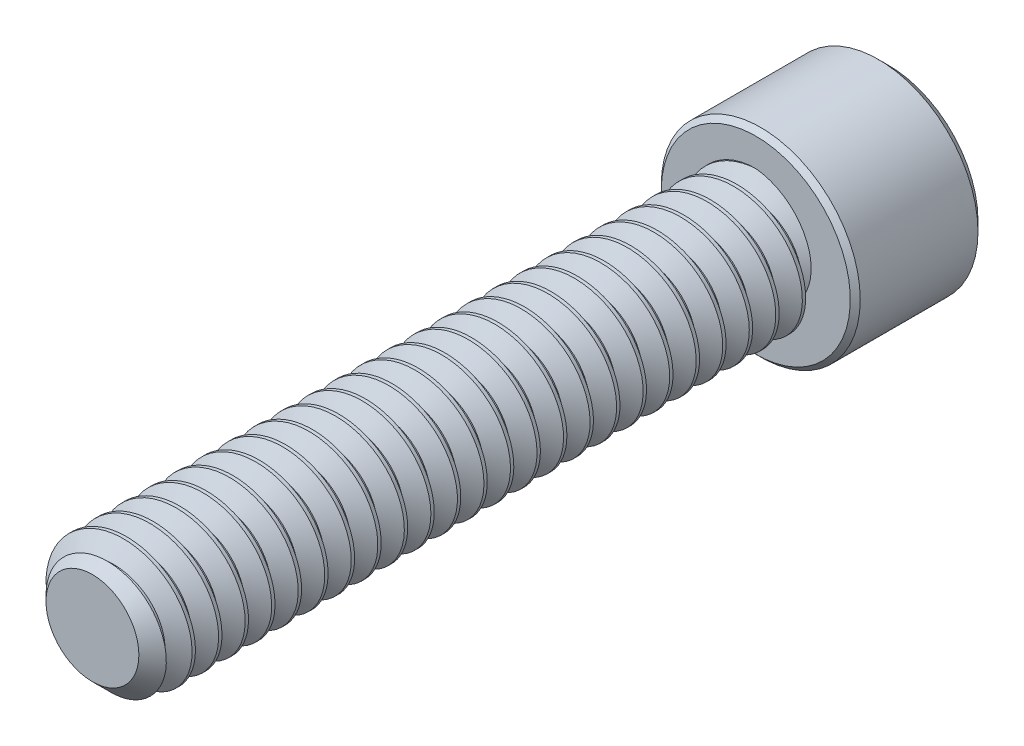
from build123d import *

# Parameters (mm, degrees)
SKETCH1_R          = 3.175
EXTRUDE1_DEPTH     = 31.75
CHAMFER3_SIZE      = 0.9525
CUT_SWEEP1_PITCH   = 1.27
SKETCH6_R          = 4.7625
EXTRUDE2_DEPTH     = 6.35
CUT_EXTRUDE1_DEPTH = 3.571875
CHAMFER1_SIZE      = 0.47625
CHAMFER2_SIZE      = 0.238125


with BuildPart() as part:
    # Sketch1 → Extrude1 (new body)
    with BuildSketch(Plane.XY):
        Circle(SKETCH1_R)
    extrude(amount=-EXTRUDE1_DEPTH)

    # Chamfer3
    chamfer3_edges = [part.edges().sort_by_distance(p)[0] for p in [
        (-3.175, 0, 0),
    ]]
    chamfer(chamfer3_edges, length=CHAMFER3_SIZE)

    # Cut-Sweep1: the profile of Sketch3 profile screwed along a right-hand helix of 26 turns, 6 arcs to a turn; built about Z, then put on its axis
    cut_sweep1_z = Axis((0, 0, 0), (0, 0, 1))
    cut_sweep1_corners = [(3.1753, 0, -1.111423205), (2.350110803, 0, -0.635), (2.350110803, 0, -0.47625), (3.1753, 0, 0.000173205)]
    with BuildLine(mode=Mode.PRIVATE) as cut_sweep1_profile:
        Line(cut_sweep1_corners[0], cut_sweep1_corners[1])
        Line(cut_sweep1_corners[1], cut_sweep1_corners[2])
        Line(cut_sweep1_corners[2], cut_sweep1_corners[3])
        Line(cut_sweep1_corners[3], cut_sweep1_corners[0])
    cut_sweep1_cap = Face(cut_sweep1_profile.wire())
    cut_sweep1_turn_angles = [0, 30, 60, 90, 120, 150, 180, 210, 240, 270, 300, 330, 360]
    cut_sweep1_turn_weights = [1, 0.8660254037844387, 1, 0.8660254037844387, 1, 0.8660254037844387, 1, 0.8660254037844387, 1, 0.8660254037844387, 1, 0.8660254037844387, 1]
    cut_sweep1_turn_rails = [Edge.make_bspline([Vector(p[0], p[1], 0).rotate(cut_sweep1_z, cut_sweep1_turn_angles[k]) / cut_sweep1_turn_weights[k] + Vector(0, 0, p[2] + CUT_SWEEP1_PITCH * cut_sweep1_turn_angles[k] / 360) for k in range(13)], [0, 0, 0, 1, 1, 2, 2, 3, 3, 4, 4, 5, 5, 6, 6, 6], 2, cut_sweep1_turn_weights) for p in cut_sweep1_corners]
    cut_sweep1_turn_sides = [Face.make_surface_from_curves(cut_sweep1_turn_rails[p[0]], cut_sweep1_turn_rails[p[1]]) for p in [(0, 1), (1, 2), (2, 3), (3, 0)]]
    cut_sweep1 = Plane(origin=(0, 0, 0), x_dir=(0, 1, 0), z_dir=(0, 0, -1)) * Solid(Shell([*[p.moved(Location((0, 0, CUT_SWEEP1_PITCH * i))) for i in range(26) for p in cut_sweep1_turn_sides], cut_sweep1_cap, cut_sweep1_cap.rotate(cut_sweep1_z, 9360).moved(Location((0, 0, CUT_SWEEP1_PITCH * 9360 / 360)))]))
    add(cut_sweep1, mode=Mode.SUBTRACT)

    # Sketch6 → Extrude2 (add)
    with BuildSketch(Plane(origin=(0, 0, -31.75), x_dir=(-1, 0, 0), z_dir=(0, 0, -1))):
        Circle(SKETCH6_R)
    extrude(amount=EXTRUDE2_DEPTH)

    # Sketch7 → Cut-Extrude1 (cut)
    with BuildSketch(Plane(origin=(0, 0, -38.1), x_dir=(-1, 0, 0), z_dir=(0, 0, -1))):
        Polygon((0, 2.749630657), (-2.38125, 1.374815329), (-2.38125, -1.374815329), (0, -2.749630657), (2.38125, -1.374815329), (2.38125, 1.374815329), align=None)
    extrude(amount=-CUT_EXTRUDE1_DEPTH, mode=Mode.SUBTRACT)

    # Cut-Extrude2 cone 1 section (through the dimple's axis) → Cut-Extrude2 (revolve, cut)
    with BuildSketch(Plane(origin=(0, 0, -38.1), x_dir=(0, 1, 0), z_dir=(1, 0, 0))):
        Polygon((0, 0), (2.749630657, 0), (0, 2.749630657), align=None)
    revolve(axis=Axis((0, 0, -38.1), (0, 0, 1)), mode=Mode.SUBTRACT)

    # Chamfer1
    chamfer1_edges = [part.edges().sort_by_distance(p)[0] for p in [
        (4.7625, 0, -38.1),
    ]]
    chamfer(chamfer1_edges, length=CHAMFER1_SIZE)

    # Chamfer2
    chamfer2_edges = [part.edges().sort_by_distance(p)[0] for p in [
        (4.7625, 0, -31.75),
    ]]
    chamfer(chamfer2_edges, length=CHAMFER2_SIZE)


solid = part.part
